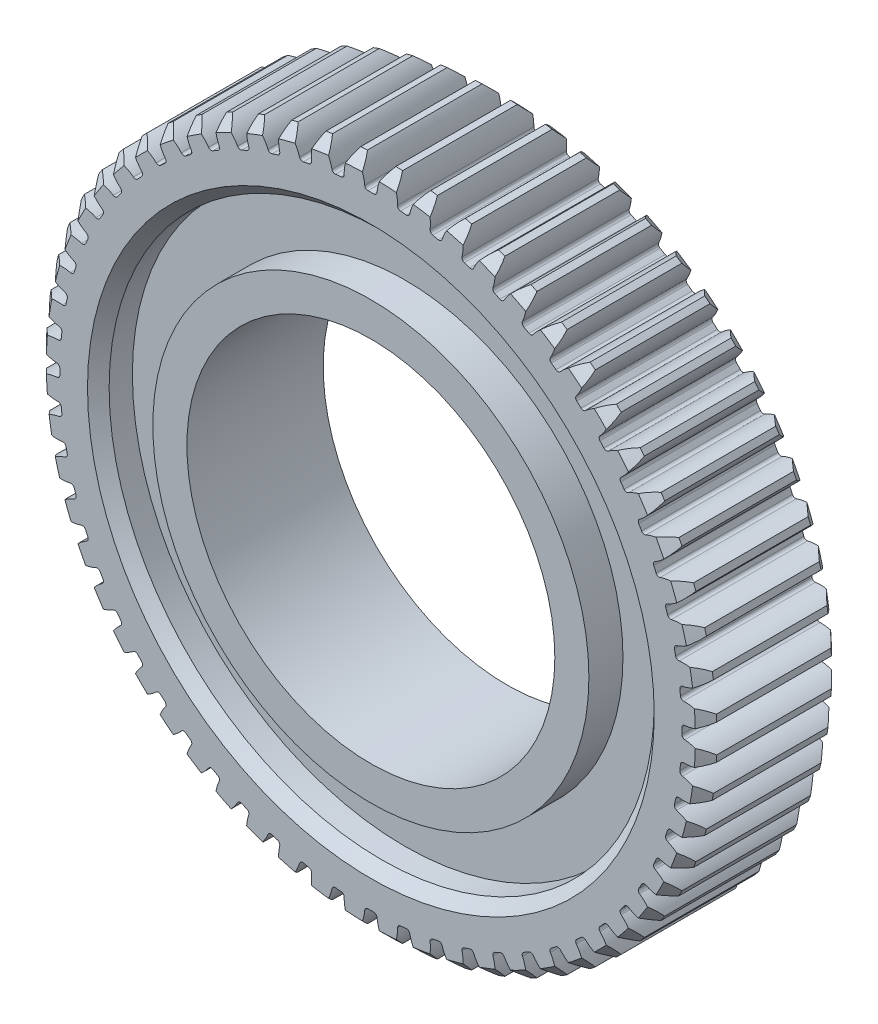
from build123d import *

# Parameters (mm, degrees)
SKETCH1_R                = 49.2125
BOSS_EXTRUDE1_DEPTH      = 10
CUT_EXTRUDE1_DEPTH       = 71.311736663
CHAMFER1_SIZE            = 1.5875
FILLET1_R                = 0.47625
CIRPATTERN1_COUNT        = 60
FILLET1_OF_CIRPATTERN1_R = 0.47625
SKETCH3_R                = 27
CUT_EXTRUDE2_DEPTH       = 54
SKETCH4_R                = 40
SKETCH4_R_2              = 32
CUT_EXTRUDE3_DEPTH       = 5
CHAMFER2_SIZE            = 1.5875
SCALE2_SCALE             = 0.25909368


with BuildPart() as part:
    # Sketch1 → Boss-Extrude1 (new, symmetric)
    with BuildSketch(Plane.XY):
        Circle(SKETCH1_R)
    extrude(amount=BOSS_EXTRUDE1_DEPTH, both=True)

    # Sketch2 → Cut-Extrude1 (cut, symmetric)
    with BuildSketch(Plane.XY):
        with BuildLine():
            ThreePointArc((-0.87851587, 45.632169138), (0, 45.640625), (0.87851587, 45.632169138))
            ThreePointArc((0.87851587, 45.632169138), (1.206438558, 47.494633789), (2.087002335, 49.168227317))
            ThreePointArc((2.087002335, 49.168227317), (0, 49.2125), (-2.087002335, 49.168227317))
            ThreePointArc((-2.087002335, 49.168227317), (-1.206438558, 47.494633789), (-0.87851587, 45.632169138))
        make_face()
    cut_extrude1 = extrude(amount=CUT_EXTRUDE1_DEPTH, both=True, mode=Mode.SUBTRACT)

    # Chamfer1
    chamfer1_edges = [part.edges().sort_by_distance(p)[0] for p in [
        (-34.052632452, -35.528697968, 10),
        (-34.052632452, -35.528697968, -10),
    ]]
    chamfer(chamfer1_edges, length=CHAMFER1_SIZE)

    # Fillet1
    fillet1_edges = [part.edges().sort_by_distance(p)[0] for p in [
        (0.87851587, 45.632169138, 0),
        (-0.87851587, 45.632169138, 0),
    ]]
    fillet(fillet1_edges, radius=FILLET1_R)

    # CirPattern1: Cut-Extrude1 ×60 about axis
    cirpattern1_axis = Axis((0, 0, 10), (0, 0, -1))
    for i in range(1, CIRPATTERN1_COUNT):
        add(cut_extrude1.rotate(cirpattern1_axis, i * 360 / CIRPATTERN1_COUNT), mode=Mode.SUBTRACT)

    # Fillet1 of CirPattern1
    fillet1_of_cirpattern1_edges = [part.edges().sort_by_distance(p)[0] for p in [
        (5.643563784, 45.290361427, 0),
        (3.896157247, 45.474021255, 0),
        (10.346779632, 44.452343039, 0),
        (8.628143251, 44.817650479, 0),
        (14.936633997, 43.127295478, 0),
        (13.265597511, 43.670248145, 0),
        (19.362839474, 41.329736243, 0),
        (17.757711109, 42.044385434, 0),
        (23.57690163, 39.079359768, 0),
        (22.055267508, 39.957875639, 0),
        (27.532650318, 36.400821651, 0),
        (26.111181781, 37.433578995, 0),
        (31.186745528, 33.323468514, 0),
        (29.881016482, 34.499152227, 0),
        (34.499152227, 29.881016482, 0),
        (33.323468514, 31.186745528, 0),
        (37.433578995, 26.111181781, 0),
        (36.400821651, 27.532650318, 0),
        (39.957875639, 22.055267508, 0),
        (39.079359768, 23.57690163, 0),
        (42.044385434, 17.757711109, 0),
        (41.329736243, 19.362839474, 0),
        (43.670248145, 13.265597511, 0),
        (43.127295478, 14.936633997, 0),
        (44.817650479, 8.628143251, 0),
        (44.452343039, 10.346779632, 0),
        (45.474021255, 3.896157247, 0),
        (45.290361427, 5.643563784, 0),
        (45.632169138, -0.87851587, 0),
        (45.632169138, 0.87851587, 0),
        (45.290361427, -5.643563784, 0),
        (45.474021255, -3.896157247, 0),
        (44.452343039, -10.346779632, 0),
        (44.817650479, -8.628143251, 0),
        (43.127295478, -14.936633997, 0),
        (43.670248145, -13.265597511, 0),
        (41.329736243, -19.362839474, 0),
        (42.044385434, -17.757711109, 0),
        (39.079359768, -23.57690163, 0),
        (39.957875639, -22.055267508, 0),
        (36.400821651, -27.532650318, 0),
        (37.433578995, -26.111181781, 0),
        (33.323468514, -31.186745528, 0),
        (34.499152227, -29.881016482, 0),
        (29.881016482, -34.499152227, 0),
        (31.186745528, -33.323468514, 0),
        (26.111181781, -37.433578995, 0),
        (27.532650318, -36.400821651, 0),
        (22.055267508, -39.957875639, 0),
        (23.57690163, -39.079359768, 0),
        (17.757711109, -42.044385434, 0),
        (19.362839474, -41.329736243, 0),
        (13.265597511, -43.670248145, 0),
        (14.936633997, -43.127295478, 0),
        (8.628143251, -44.817650479, 0),
        (10.346779632, -44.452343039, 0),
        (3.896157247, -45.474021255, 0),
        (5.643563784, -45.290361427, 0),
        (-0.87851587, -45.632169138, 0),
        (0.87851587, -45.632169138, 0),
        (-5.643563784, -45.290361427, 0),
        (-3.896157247, -45.474021255, 0),
        (-10.346779632, -44.452343039, 0),
        (-8.628143251, -44.817650479, 0),
        (-14.936633997, -43.127295478, 0),
        (-13.265597511, -43.670248145, 0),
        (-19.362839474, -41.329736243, 0),
        (-17.757711109, -42.044385434, 0),
        (-23.57690163, -39.079359768, 0),
        (-22.055267508, -39.957875639, 0),
        (-27.532650318, -36.400821651, 0),
        (-26.111181781, -37.433578995, 0),
        (-31.186745528, -33.323468514, 0),
        (-29.881016482, -34.499152227, 0),
        (-34.499152227, -29.881016482, 0),
        (-33.323468514, -31.186745528, 0),
        (-37.433578995, -26.111181781, 0),
        (-36.400821651, -27.532650318, 0),
        (-39.957875639, -22.055267508, 0),
        (-39.079359768, -23.57690163, 0),
        (-42.044385434, -17.757711109, 0),
        (-41.329736243, -19.362839474, 0),
        (-43.670248145, -13.265597511, 0),
        (-43.127295478, -14.936633997, 0),
        (-44.817650479, -8.628143251, 0),
        (-44.452343039, -10.346779632, 0),
        (-45.474021255, -3.896157247, 0),
        (-45.290361427, -5.643563784, 0),
        (-45.632169138, 0.87851587, 0),
        (-45.632169138, -0.87851587, 0),
        (-45.290361427, 5.643563784, 0),
        (-45.474021255, 3.896157247, 0),
        (-44.452343039, 10.346779632, 0),
        (-44.817650479, 8.628143251, 0),
        (-43.127295478, 14.936633997, 0),
        (-43.670248145, 13.265597511, 0),
        (-41.329736243, 19.362839474, 0),
        (-42.044385434, 17.757711109, 0),
        (-39.079359768, 23.57690163, 0),
        (-39.957875639, 22.055267508, 0),
        (-36.400821651, 27.532650318, 0),
        (-37.433578995, 26.111181781, 0),
        (-33.323468514, 31.186745528, 0),
        (-34.499152227, 29.881016482, 0),
        (-29.881016482, 34.499152227, 0),
        (-31.186745528, 33.323468514, 0),
        (-26.111181781, 37.433578995, 0),
        (-27.532650318, 36.400821651, 0),
        (-22.055267508, 39.957875639, 0),
        (-23.57690163, 39.079359768, 0),
        (-17.757711109, 42.044385434, 0),
        (-19.362839474, 41.329736243, 0),
        (-13.265597511, 43.670248145, 0),
        (-14.936633997, 43.127295478, 0),
        (-8.628143251, 44.817650479, 0),
        (-10.346779632, 44.452343039, 0),
        (-3.896157247, 45.474021255, 0),
        (-5.643563784, 45.290361427, 0),
    ]]
    fillet(fillet1_of_cirpattern1_edges, radius=FILLET1_OF_CIRPATTERN1_R)

    # Sketch3 → Cut-Extrude2 (cut)
    with BuildSketch(Plane.XY.offset(10)):
        Circle(SKETCH3_R)
    extrude(amount=-CUT_EXTRUDE2_DEPTH, mode=Mode.SUBTRACT)

    # Sketch4 → Cut-Extrude3 (cut)
    with BuildSketch(Plane.XY.offset(10)):
        Circle(SKETCH4_R)
        Circle(SKETCH4_R_2, mode=Mode.SUBTRACT)
    cut_extrude3 = extrude(amount=-CUT_EXTRUDE3_DEPTH, mode=Mode.SUBTRACT)

    # Mirror1: Cut-Extrude3 across plane
    add(cut_extrude3.mirror(Plane.XY), mode=Mode.SUBTRACT)

    # Chamfer2
    chamfer2_edges = [part.edges().sort_by_distance(p)[0] for p in [
        (-40, 0, -10),
        (-40, 0, 10),
    ]]
    chamfer(chamfer2_edges, length=CHAMFER2_SIZE)


with BuildPart() as part_1:
    # Scale2: scaled about (0, 0, 0)
    add(part.part.scale(SCALE2_SCALE))


solid = part_1.part
